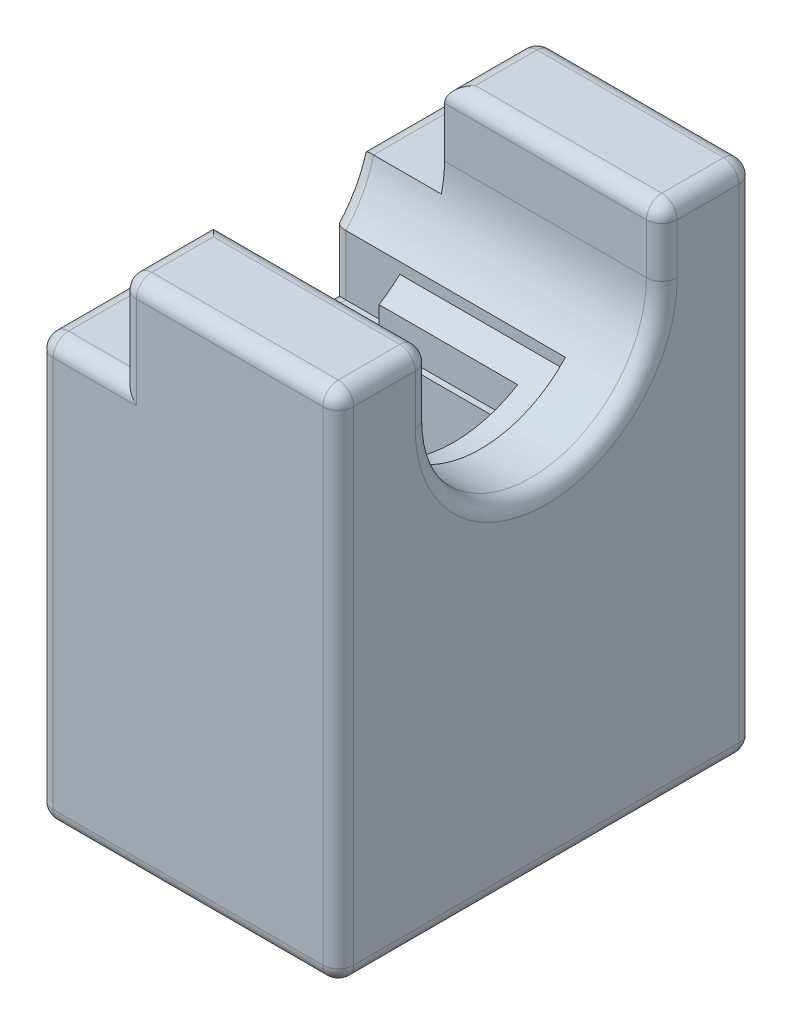
from build123d import *

# Parameters (mm, degrees)
CROQUIS18_W                  = 39
CROQUIS18_H                  = 54
SALIENTE_EXTRUIR8_DEPTH      = 40.280661595
SALIENTE_EXTRUIR9_REACH      = 87.298
SALIENTE_EXTRUIR9_END_RADIUS = 16
SALIENTE_EXTRUIR10_DEPTH     = 26.5
CORTAR_EXTRUIR8_START        = -39
CROQUIS22_R                  = 15
CORTAR_EXTRUIR8_DEPTH        = 39
CORTAR_EXTRUIR9_DEPTH        = 84.025081472
CROQUIS24_W                  = 10.8
CROQUIS24_H                  = 54
CORTAR_EXTRUIR10_DEPTH       = 12
CROQUIS25_R                  = 2.25
CORTAR_EXTRUIR11_DEPTH       = 24.2
REDONDEO1_R                  = 2
REDONDEO2_R                  = 2
CROQUIS26_R                  = 2.25
CORTAR_EXTRUIR12_DEPTH       = 30
CROQUIS27_W                  = 15
CROQUIS27_H                  = 15
CORTAR_EXTRUIR13_DEPTH       = 101.562974791


with BuildPart() as part:
    # Croquis18 → Saliente-Extruir8 (new body)
    with BuildSketch(Plane(origin=(0, 0, 0), x_dir=(1, 0, 0), z_dir=(0, 1, 0))):
        with Locations((49.353088131, -3.207737261)):
            Rectangle(CROQUIS18_W, CROQUIS18_H)
    extrude(amount=SALIENTE_EXTRUIR8_DEPTH)

    # Saliente-Extruir9: up to this cylinder (the profile starts outside it)
    saliente_extruir9_end = Plane(origin=(39.1607, 58.280661595, 3.207737261), z_dir=(1, 0, 0)) * Cylinder(SALIENTE_EXTRUIR9_END_RADIUS, 207.596, mode=Mode.PRIVATE)
    # Croquis20 → Saliente-Extruir9 (add, up to the surface)
    with BuildSketch(Plane(origin=(0, 40.280661595, 0), x_dir=(1, 0, 0), z_dir=(0, 1, 0)), mode=Mode.PRIVATE) as saliente_extruir9_sk1:
        Polygon((38.853088131, -11.507737261), (38.853088131, -14.207737261), (60.353088131, -14.207737261), (60.353088131, 7.792262739), (38.853088131, 7.792262739), (38.853088131, 5.092262739), (56.853088131, 5.092262739), (56.853088131, -11.507737261), align=None)
    saliente_extruir9_tool1 = extrude(saliente_extruir9_sk1.sketch, amount=SALIENTE_EXTRUIR9_REACH, mode=Mode.PRIVATE) - saliente_extruir9_end
    add(saliente_extruir9_tool1.solids().sort_by_distance((39.1607, 40.280662, 12.857737))[0])

    # Croquis21 → Saliente-Extruir10 (add)
    with BuildSketch(Plane(origin=(0, 40.280661595, 0), x_dir=(1, 0, 0), z_dir=(0, 1, 0))):
        Polygon((68.853088131, 23.792262739), (29.853088131, 23.792262739), (29.853088131, 7.792262739), (60.353088131, 7.792262739), (60.353088131, -14.207737261), (29.853088131, -14.207737261), (29.853088131, -30.207737261), (68.853088131, -30.207737261), align=None)
    extrude(amount=SALIENTE_EXTRUIR10_DEPTH)

    # Croquis22 → Cortar-Extruir8 (cut)
    with BuildSketch(Plane(origin=(68.853088131, 0, 0), x_dir=(0, 0, -1), z_dir=(1, 0, 0)).offset(CORTAR_EXTRUIR8_START)):
        with Locations((-3.207737261, 58.280661595)):
            Circle(CROQUIS22_R)
    extrude(amount=CORTAR_EXTRUIR8_DEPTH, mode=Mode.SUBTRACT)

    # Croquis23 → Cortar-Extruir9 (cut, through all)
    with BuildSketch(Plane(origin=(68.853088131, 0, 0), x_dir=(0, 0, -1), z_dir=(1, 0, 0))):
        with BuildLine():
            Line((-15.566944355, 66.780661595), (-18.207737261, 66.780661595))
            Line((-18.207737261, 66.780661595), (-18.207737261, 58.280661595))
            ThreePointArc((-18.207737261, 58.280661595), (-17.532333353, 62.731048859), (-15.566944355, 66.780661595))
        make_face()
        with BuildLine():
            ThreePointArc((9.151469833, 66.780661595), (11.116858831, 62.731048859), (11.792262739, 58.280661595))
            Line((11.792262739, 58.280661595), (11.792262739, 66.780661595))
            Line((11.792262739, 66.780661595), (9.151469833, 66.780661595))
        make_face()
    extrude(amount=-CORTAR_EXTRUIR9_DEPTH, mode=Mode.SUBTRACT)

    # Croquis24 → Cortar-Extruir10 (cut)
    with BuildSketch(Plane(origin=(0, 66.780661595, 0), x_dir=(1, 0, 0), z_dir=(0, 1, 0))):
        with Locations((35.253088131, -3.207737261)):
            Rectangle(CROQUIS24_W, CROQUIS24_H)
    extrude(amount=-CORTAR_EXTRUIR10_DEPTH, mode=Mode.SUBTRACT)

    # Croquis25 → Cortar-Extruir11 (cut)
    with BuildSketch(Plane.ZY.offset(-40.653088131)):
        with Locations(Location((20.707737261, 58.280661595, 0), (0, 0, 270))):
            Circle(CROQUIS25_R)
        with Locations(Location((-14.292262739, 58.280661595, 0), (0, 0, 270))):
            Circle(CROQUIS25_R)
    extrude(amount=-CORTAR_EXTRUIR11_DEPTH, mode=Mode.SUBTRACT)

    # Redondeo1
    redondeo1_edges = [part.edges().sort_by_distance(p)[0] for p in [
        (68.853088131, 62.530661595, 18.207737261),
        (68.853088131, 62.530661595, -11.792262739),
        (68.853088131, 33.390330798, -23.792262739),
        (54.753088131, 66.780661595, 30.207737261),
        (29.853088131, 27.390330798, 30.207737261),
        (68.853088131, 33.390330798, 30.207737261),
        (29.853088131, 27.390330798, -23.792262739),
        (29.853088131, 51.200842989, -10.016338076),
        (29.853088131, 54.780661595, -17.585238812),
        (29.853088131, 54.780661595, 24.000713334),
        (40.653088131, 60.780661595, -23.792262739),
        (35.253088131, 54.780661595, -23.792262739),
        (35.253088131, 54.780661595, 30.207737261),
        (40.653088131, 60.780661595, 30.207737261),
        (29.853088131, 40.280661595, 3.207737261),
        (49.353088131, 0, -23.792262739),
        (68.853088131, 0, 3.207737261),
        (68.853088131, 66.780661595, 24.207737261),
        (54.753088131, 66.780661595, -23.792262739),
        (49.353088131, 0, 30.207737261),
        (29.853088131, 0, 3.207737261),
        (29.853088131, 44.181642082, -7.792262739),
        (29.853088131, 44.181642082, 14.207737261),
        (29.853088131, 51.200842989, 16.431812597),
        (68.853088131, 43.280661596, 3.207737261),
        (68.853088131, 66.780661595, -17.792262739),
    ]]
    fillet(redondeo1_edges, radius=REDONDEO1_R)

    # Redondeo2
    # the kernel refuses this fillet: 2 mm, written as the material it takes off along each edge
    with BuildSketch(Plane(origin=(66.853088131, 64.780661595, -13.792262739), x_dir=(0, 1, 0), z_dir=(0, 0, 1))) as redondeo2_piece_1_section:
        Polygon((0, 0), (REDONDEO2_R, 0), (REDONDEO2_R, -REDONDEO2_R), (0, -REDONDEO2_R), align=None)
    redondeo2_piece_1 = extrude(amount=REDONDEO2_R, mode=Mode.PRIVATE)
    redondeo2_piece_1 = redondeo2_piece_1 - Plane(origin=(66.853088131, 64.780661595, -13.792262739), x_dir=(-0.7071067811865475, -0.7071067811865476, 0), z_dir=(0, 0, 1)) * Sphere(REDONDEO2_R, mode=Mode.PRIVATE)
    add(redondeo2_piece_1, mode=Mode.SUBTRACT)
    with BuildSketch(Plane(origin=(66.853088131, 64.780661595, 20.207737261), x_dir=(0, 0, -1), z_dir=(0, 1, 0))) as redondeo2_piece_2_section:
        Polygon((0, 0), (REDONDEO2_R, 0), (REDONDEO2_R, -REDONDEO2_R), (0, -REDONDEO2_R), align=None)
    redondeo2_piece_2 = extrude(amount=REDONDEO2_R, mode=Mode.PRIVATE)
    redondeo2_piece_2 = redondeo2_piece_2 - Plane(origin=(66.853088131, 64.780661595, 20.207737261), x_dir=(-0.7071067811865475, 0, 0.7071067811865475), z_dir=(0, 1, 0)) * Sphere(REDONDEO2_R, mode=Mode.PRIVATE)
    add(redondeo2_piece_2, mode=Mode.SUBTRACT)
    with BuildSketch(Plane(origin=(42.653088131, 64.780661595, -21.792262739), x_dir=(0, 1, 0), z_dir=(-1, 0, 0))) as redondeo2_piece_3_section:
        Polygon((0, 0), (REDONDEO2_R, 0), (REDONDEO2_R, REDONDEO2_R), (0, REDONDEO2_R), align=None)
    redondeo2_piece_3 = extrude(amount=REDONDEO2_R, mode=Mode.PRIVATE)
    redondeo2_piece_3 = redondeo2_piece_3 - Plane(origin=(42.653088131, 64.780661595, -21.792262739), x_dir=(0, -0.7071067811865475, 0.7071067811865475), z_dir=(-1, 0, 0)) * Sphere(REDONDEO2_R, mode=Mode.PRIVATE)
    add(redondeo2_piece_3, mode=Mode.SUBTRACT)
    with BuildSketch(Plane(origin=(42.653088131, 64.780661595, 28.207737261), x_dir=(-1, 0, 0), z_dir=(0, 1, 0))) as redondeo2_piece_4_section:
        Polygon((0, 0), (REDONDEO2_R, 0), (REDONDEO2_R, REDONDEO2_R), (0, REDONDEO2_R), align=None)
    redondeo2_piece_4 = extrude(amount=REDONDEO2_R, mode=Mode.PRIVATE)
    redondeo2_piece_4 = redondeo2_piece_4 - Plane(origin=(42.653088131, 64.780661595, 28.207737261), x_dir=(0.7071067811865475, 0, -0.7071067811865476), z_dir=(0, 1, 0)) * Sphere(REDONDEO2_R, mode=Mode.PRIVATE)
    add(redondeo2_piece_4, mode=Mode.SUBTRACT)
    with BuildSketch(Plane(origin=(66.853088131, 66.780661595, 18.207737261), x_dir=(0, -1.5546675058430992e-10, 1.0), z_dir=(-1, 0, 0)), Plane(origin=(66.853088131, 66.780661595, -11.792262739), x_dir=(0, -1, 0), z_dir=(-1, 0, 0))) as redondeo2_piece_5:
        with BuildLine():
            CenterArc((REDONDEO2_R, -REDONDEO2_R), REDONDEO2_R, 90.000000009, 90)
            Line((REDONDEO2_R * 1.55466750608e-10, -REDONDEO2_R), (0, 0))
            Line((0, 0), (REDONDEO2_R, 0))
        make_face()
    extrude(amount=31.200000001, mode=Mode.SUBTRACT)
    with BuildSketch(Plane(origin=(40.653088131, 66.780661595, -6.792262738), x_dir=(0, -1, 0), z_dir=(0, 0, -1))) as redondeo2_piece_6:
        with BuildLine():
            CenterArc((REDONDEO2_R, -REDONDEO2_R), REDONDEO2_R, 90, 90)
            Line((0, -REDONDEO2_R), (0, 0))
            Line((0, 0), (REDONDEO2_R, 0))
        make_face()
    extrude(amount=15.000000001, mode=Mode.SUBTRACT)
    with BuildSketch(Plane(origin=(40.653088131, 66.780661595, 28.207737261), x_dir=(1.0, -1.5546675058430992e-10, 0), z_dir=(0, 0, -1))) as redondeo2_piece_7:
        with BuildLine():
            CenterArc((REDONDEO2_R, REDONDEO2_R), REDONDEO2_R, 179.999999991, 90)
            Line((REDONDEO2_R * 1.55466750608e-10, REDONDEO2_R), (0, 0))
            Line((0, 0), (REDONDEO2_R, 0))
        make_face()
    extrude(amount=15.000000001, mode=Mode.SUBTRACT)

    # Croquis26 → Cortar-Extruir12 (cut)
    with BuildSketch(Plane.XZ):
        with Locations(Location((39.853088131, 20.207737261, 0), (0, 0, 270))):
            Circle(CROQUIS26_R)
        with Locations(Location((58.853088131, 20.207737261, 0), (0, 0, 270))):
            Circle(CROQUIS26_R)
        with Locations(Location((39.853088131, -13.792262739, 0), (0, 0, 270))):
            Circle(CROQUIS26_R)
        with Locations(Location((58.853088131, -13.792262739, 0), (0, 0, 270))):
            Circle(CROQUIS26_R)
    extrude(amount=-CORTAR_EXTRUIR12_DEPTH, mode=Mode.SUBTRACT)

    # Croquis27 → Cortar-Extruir13 (cut, through all)
    with BuildSketch(Plane.XZ):
        with Locations((49.353088131, 3.207737261)):
            Rectangle(CROQUIS27_W, CROQUIS27_H)
    extrude(amount=-CORTAR_EXTRUIR13_DEPTH, mode=Mode.SUBTRACT)


solid = part.part
